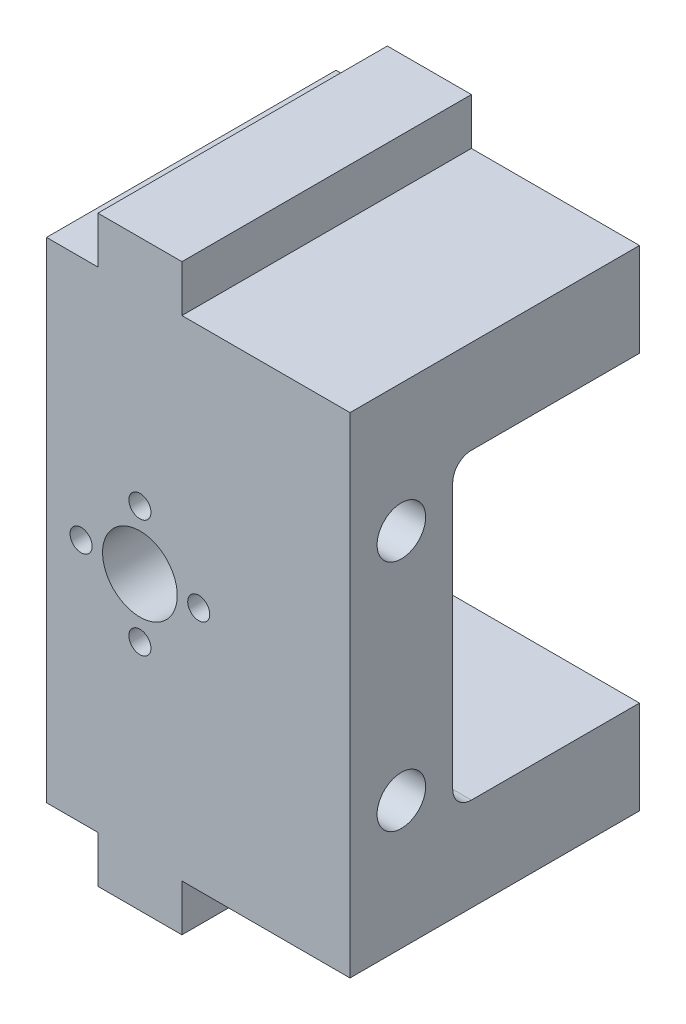
from build123d import *

# Parameters (mm, degrees)
SKETCH1_R           = 1.499997
SKETCH1_R_2         = 5.08
BOSS_EXTRUDE1_DEPTH = 13.97
CUT_EXTRUDE1_DEPTH  = 3
FILLET1_R           = 1.27
SKETCH3_R           = 3.302
CUT_EXTRUDE2_DEPTH  = 41.275
CUT_EXTRUDE3_DEPTH  = 5.842
BOSS_EXTRUDE2_DEPTH = 25.4
FILLET2_R           = 2.54


with BuildPart() as part:
    # Sketch1 → Boss-Extrude1 (new body)
    with BuildSketch(Plane.XY):
        Polygon((-12.7, 33.2994), (-5.715, 33.2994), (-5.715, 39.6494), (5.715, 39.6494), (5.715, 33.2994), (28.575, 33.2994), (28.575, -33.2994), (5.715, -33.2994), (5.715, -39.6494), (-5.715, -39.6494), (-5.715, -33.2994), (-12.7, -33.2994), align=None)
        with Locations((0, 8.001)):
            Circle(SKETCH1_R, mode=Mode.SUBTRACT)
        with Locations((8.001, 0)):
            Circle(SKETCH1_R, mode=Mode.SUBTRACT)
        Circle(SKETCH1_R_2, mode=Mode.SUBTRACT)
        with Locations((0, -8.001)):
            Circle(SKETCH1_R, mode=Mode.SUBTRACT)
        with Locations((-8.001, 0)):
            Circle(SKETCH1_R, mode=Mode.SUBTRACT)
    extrude(amount=BOSS_EXTRUDE1_DEPTH)

    # Sketch2 → Cut-Extrude1 (cut)
    with BuildSketch(Plane(origin=(0, 0, 0), x_dir=(-1, 0, 0), z_dir=(0, 0, -1))):
        Polygon((8.001, -3.579571669), (11.101, -1.789785834), (11.101, 1.789785834), (8.001, 3.579571669), (4.901, 1.789785834), (4.901, -1.789785834), align=None)
        Polygon((3.579571669, 8.001), (1.789785834, 11.101), (-1.789785834, 11.101), (-3.579571669, 8.001), (-1.789785834, 4.901), (1.789785834, 4.901), align=None)
        Polygon((-3.579571669, -8.001), (-1.789785834, -11.101), (1.789785834, -11.101), (3.579571669, -8.001), (1.789785834, -4.901), (-1.789785834, -4.901), align=None)
        Polygon((-8.001, 3.579571669), (-11.101, 1.789785834), (-11.101, -1.789785834), (-8.001, -3.579571669), (-4.901, -1.789785834), (-4.901, 1.789785834), align=None)
    extrude(amount=-CUT_EXTRUDE1_DEPTH, mode=Mode.SUBTRACT)

    # Fillet1
    # the kernel refuses this fillet: 1.27 mm, written as the material it takes off along each edge
    with BuildSketch(Plane(origin=(-4.901, -1.336637198, 3), x_dir=(0.3505491054701989, -0.9365443527425935, 0), z_dir=(0, 0, -1)), Plane(origin=(-1.336637198, 4.901, 3), x_dir=(-0.9365443527425947, -0.3505491054701953, 0), z_dir=(0, 0, -1)), Plane(origin=(1.336637198, -4.901, 3), x_dir=(0.9365443527425922, 0.3505491054702024, 0), z_dir=(0, 0, -1))) as fillet1_piece_1:
        with BuildLine():
            CenterArc((1.048997579, 1.264640212), FILLET1_R, 240.540119445, 24.194103812)
            Line((0.424393796, 0.158850849), (0, 0))
            ThreePointArc((0, 0), (0.466221146, 0.021439153), (0.932442292, 0))
        make_face()
    extrude(amount=5.331105731, mode=Mode.SUBTRACT)
    with BuildSketch(Plane(origin=(-4.901, 1.336637198, 3), x_dir=(0.35054910547019297, 0.9365443527425957, 0), z_dir=(0, 0, -1)), Plane(origin=(1.336637198, 4.901, 3), x_dir=(0.9365443527425946, -0.3505491054701959, 0), z_dir=(0, 0, -1)), Plane(origin=(-1.336637198, -4.901, 3), x_dir=(-0.9365443527425968, 0.35054910547018975, 0), z_dir=(0, 0, -1))) as fillet1_piece_2:
        with BuildLine():
            CenterArc((1.048997579, -1.264640212), FILLET1_R, 95.265776743, 24.194103812)
            Line((0.424393796, -0.158850849), (0, 0))
            ThreePointArc((0, 0), (0.466221146, -0.021439153), (0.932442292, 0))
        make_face()
    extrude(amount=5.331105731, mode=Mode.SUBTRACT)
    with BuildSketch(Plane(origin=(4.901, 1.336637198, 3), x_dir=(0, 1, 0), z_dir=(0, 0, -1))) as fillet1_piece_3:
        with BuildLine():
            CenterArc((1.425751253, 0.816666486), FILLET1_R, 220.019214916, 24.194103812)
            ThreePointArc((0.873273563, -0.326866811), (0.444152257, -0.143354688), (0, 0))
            Line((0, 0), (0.453148636, 0))
        make_face()
    extrude(amount=5.331105731, mode=Mode.SUBTRACT)
    with BuildSketch(Plane(origin=(4.901, -1.336637198, 3), x_dir=(0, -1, 0), z_dir=(0, 0, -1))) as fillet1_piece_4:
        with BuildLine():
            CenterArc((1.425751253, -0.816666486), FILLET1_R, 115.786681272, 24.194103812)
            ThreePointArc((0.873273563, 0.326866811), (0.444152257, 0.143354688), (0, 0))
            Line((0, 0), (0.453148636, 0))
        make_face()
    extrude(amount=5.331105731, mode=Mode.SUBTRACT)

    # Sketch3 → Cut-Extrude2 (cut)
    with BuildSketch(Plane(origin=(28.575, 0, 0), x_dir=(0, 0, -1), z_dir=(1, 0, 0))):
        with Locations((-6.985, 15.875)):
            Circle(SKETCH3_R)
        with Locations(Location((-6.985, -15.875, 0), (0, 0, 90))):
            Circle(SKETCH3_R)
    extrude(amount=-CUT_EXTRUDE2_DEPTH, mode=Mode.SUBTRACT)

    # Sketch4 → Cut-Extrude3 (cut)
    with BuildSketch(Plane.ZY.offset(12.7)):
        Polygon((12.7, -19.174556788), (6.985, -22.474113577), (1.27, -19.174556788), (1.27, -12.575443212), (6.985, -9.275886423), (12.7, -12.575443212), align=None)
        Polygon((6.985, 22.474113577), (1.27, 19.174556788), (1.27, 12.575443212), (6.985, 9.275886423), (12.7, 12.575443212), (12.7, 19.174556788), align=None)
    extrude(amount=-CUT_EXTRUDE3_DEPTH, mode=Mode.SUBTRACT)

    # Sketch5 → Boss-Extrude2 (add)
    with BuildSketch(Plane(origin=(0, 0, 0), x_dir=(-1, 0, 0), z_dir=(0, 0, -1))):
        Polygon((-28.575, 20.5994), (12.7, 20.5994), (12.7, 33.2994), (5.715, 33.2994), (5.715, 39.6494), (-5.715, 39.6494), (-5.715, 33.2994), (-28.575, 33.2994), align=None)
        Polygon((12.7, -20.5994), (-28.575, -20.5994), (-28.575, -33.2994), (-5.715, -33.2994), (-5.715, -39.6494), (5.715, -39.6494), (5.715, -33.2994), (12.7, -33.2994), align=None)
    extrude(amount=BOSS_EXTRUDE2_DEPTH)

    # Fillet2
    fillet2_edges = [part.edges().sort_by_distance(p)[0] for p in [
        (7.9375, -20.5994, 0),
        (7.9375, 20.5994, 0),
    ]]
    fillet(fillet2_edges, radius=FILLET2_R)


solid = part.part
